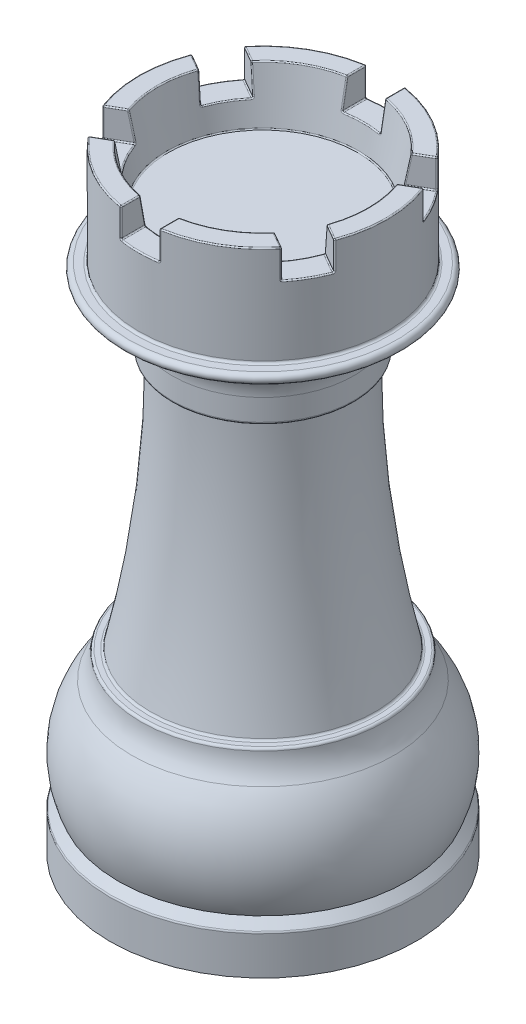
from build123d import *

# Parameters (mm, degrees)
CUT_EXTRUDE3_DEPTH = 3
FILLET1_R          = 0.125
SCALE1_SCALE       = 0.71875
SKETCH3_R          = 10.2
CUT_EXTRUDE4_DEPTH = 9
SKETCH6_W          = 10.75
SKETCH6_H          = 1


with BuildPart() as part:
    # Sketch1 → Revolve1 (revolve)
    with BuildSketch(Plane.XY):
        with BuildLine():
            Line((16, 4), (16, 0))
            Line((16, 0), (0, 0))
            Line((0, 0), (0, 58.5))
            Line((0, 58.5), (10.030205099, 58.5))
            Line((10.030205099, 58.5), (11, 63.99998019))
            Line((11, 63.99998019), (13, 63.99998019))
            Line((13, 63.99998019), (13, 53.78125))
            ThreePointArc((13, 53.78125), (13.073223305, 53.604473305), (13.25, 53.53125))
            Line((13.25, 53.53125), (14.03125, 53.53125))
            ThreePointArc((14.03125, 53.53125), (14.53125, 53.03125), (14.03125, 52.53125))
            ThreePointArc((14.03125, 52.53125), (10.827172398, 51.204077602), (9.5, 48))
            Line((9.5, 48), (9.5, 45.75))
            ThreePointArc((9.5, 45.75), (9.426776695, 45.573223305), (9.25, 45.5))
            Line((9.25, 45.5), (9, 45.5))
            ThreePointArc((9, 45.5), (8.823531814, 45.427084667), (8.75000152, 45.250871834))
            ThreePointArc((8.75000152, 45.250871834), (9.480787471, 31.884631978), (11.756493413, 18.693287147))
            ThreePointArc((11.756493413, 18.693287147), (11.844552759, 18.554195339), (12, 18.5))
            Line((12, 18.5), (12.5, 18.5))
            ThreePointArc((12.5, 18.5), (12.672025963, 18.431403054), (12.749648281, 18.263256543))
            ThreePointArc((12.749648281, 18.263256543), (13.034996076, 16.915224998), (13.719280159, 15.719245189))
            ThreePointArc((13.719280159, 15.719245189), (15.914405684, 10.553717167), (15.103553391, 5))
            Line((15.103553391, 5), (15.926776695, 4.176776695))
            ThreePointArc((15.926776695, 4.176776695), (15.980969883, 4.095670858), (16, 4))
        make_face()
    revolve(axis=Axis((0, 0, 0), (0, -1, 0)))

    # Sketch2 → Cut-Extrude3 (cut)
    with BuildSketch(Plane(origin=(0, 63.99998019, 0), x_dir=(1, 0, 0), z_dir=(0, 1, 0))):
        Polygon((13.46466686, 5.464427959), (11.46466686, 8.928529574), (2, 3.464101615), (2, 14.392957534), (-2, 14.392957534), (-2, 3.464101615), (-11.46466686, 8.928529574), (-13.46466686, 5.464427959), (-4, 0), (-13.46466686, -5.464427959), (-11.46466686, -8.928529574), (-2, -3.464101615), (-2, -14.392957534), (2, -14.392957534), (2, -3.464101615), (11.46466686, -8.928529574), (13.46466686, -5.464427959), (4, 0), align=None)
    extrude(amount=-CUT_EXTRUDE3_DEPTH, mode=Mode.SUBTRACT)

    # Fillet1
    fillet1_edges = [part.edges().sort_by_distance(p)[0] for p in [
        (12.124297731, 62.49998019, -4.690565482),
        (10.124297731, 62.49998019, -8.154667097),
        (2, 62.49998019, -12.845232579),
        (-2, 62.49998019, -12.845232579),
        (-10.124297731, 62.49998019, -8.154667097),
        (-12.124297731, 62.49998019, -4.690565482),
        (-12.124297731, 62.49998019, 4.690565482),
        (-10.124297731, 62.49998019, 8.154667097),
        (-2, 62.49998019, 12.845232579),
        (2, 62.49998019, 12.845232579),
        (10.124297731, 62.49998019, 8.154667097),
        (12.124297731, 62.49998019, 4.690565482),
        (6.5, 63.99998019, -11.258330249),
        (9.245897364, 63.99998019, -7.647522409),
        (2, 63.99998019, -11.830943203),
        (-9.245897364, 63.99998019, -7.647522409),
        (-6.5, 63.99998019, -11.258330249),
        (-2, 63.99998019, -11.830943203),
        (-11.245897364, 63.99998019, -4.183420794),
        (-11.245897364, 63.99998019, 4.183420794),
        (-13, 63.99998019, 0),
        (-9.245897364, 63.99998019, 7.647522409),
        (-2, 63.99998019, 11.830943203),
        (-6.5, 63.99998019, 11.258330249),
        (9.245897364, 63.99998019, 7.647522409),
        (6.5, 63.99998019, 11.258330249),
        (2, 63.99998019, 11.830943203),
        (12.77919932, 63.99998019, -2.385804843),
        (11.245897364, 63.99998019, 4.183420794),
        (11.245897364, 63.99998019, -4.183420794),
        (11.012757815, 60.99998019, -4.048817612),
        (9.012757815, 60.99998019, -7.512919227),
        (11.258330249, 60.99998019, -6.5),
        (2, 60.99998019, -11.561736839),
        (-2, 60.99998019, -11.561736839),
        (0, 60.99998019, -13),
        (-9.012757815, 60.99998019, -7.512919227),
        (-11.012757815, 60.99998019, -4.048817612),
        (-11.258330249, 60.99998019, -6.5),
        (-11.012757815, 60.99998019, 4.048817612),
        (-9.012757815, 60.99998019, 7.512919227),
        (-11.258330249, 60.99998019, 6.5),
        (-2, 60.99998019, 11.561736839),
        (2, 60.99998019, 11.561736839),
        (0, 60.99998019, 13),
        (9.012757815, 60.99998019, 7.512919227),
        (11.012757815, 60.99998019, 4.048817612),
        (11.258330249, 60.99998019, 6.5),
        (-9.068168508, 60.99998019, 5.235509529),
        (-10.13445755, 62.499959445, 3.541730718),
        (-11, 63.99998019, 0),
        (-10.13445755, 62.499959445, -3.541730718),
        (-9.068168508, 60.99998019, -5.235509529),
        (-8.13445755, 62.499959445, -7.005832333),
        (-5.5, 63.99998019, -9.526279442),
        (-2, 62.499959445, -10.547563051),
        (0, 60.99998019, -10.471019058),
        (2, 62.499959445, -10.547563051),
        (5.5, 63.99998019, -9.526279442),
        (8.13445755, 62.499959445, -7.005832333),
        (9.068168508, 60.99998019, -5.235509529),
        (10.13445755, 62.499959445, -3.541730718),
        (10.840721078, 63.99998019, -1.865145172),
        (10.13445755, 62.499959445, 3.541730718),
        (9.068168508, 60.99998019, 5.235509529),
        (8.13445755, 62.499959445, 7.005832333),
        (5.5, 63.99998019, 9.526279442),
        (2, 62.499959445, 10.547563051),
        (0, 60.99998019, 10.471019058),
        (-2, 62.499959445, 10.547563051),
        (-5.5, 63.99998019, 9.526279442),
        (-8.13445755, 62.499959445, 7.005832333),
        (-10.030205099, 58.5, 0),
    ]]
    fillet(fillet1_edges, radius=FILLET1_R)


with BuildPart() as part_1:
    # Scale1: scaled about (0, 0, 0)
    add(part.part.scale(SCALE1_SCALE))

    # Sketch3 → Cut-Extrude4 (cut)
    with BuildSketch(Plane.XZ):
        Circle(SKETCH3_R)
    extrude(amount=-CUT_EXTRUDE4_DEPTH, mode=Mode.SUBTRACT)

    # Sketch6 → Cut-Revolve1 (revolve, cut)
    with BuildSketch(Plane.XY):
        with Locations((-5.375, 0.5)):
            Rectangle(SKETCH6_W, SKETCH6_H)
    revolve(axis=Axis((0, 0, 0), (0, -1, 0)), mode=Mode.SUBTRACT)


with BuildPart() as body_2:
    # Sketch8 → Base (White Rook) (revolve)
    with BuildSketch(Plane.XY):
        Polygon((-10, 2.5), (-10, 1), (-10.55, 1), (-10.55, 0), (0, 0), (0, 2.5), align=None)
    revolve(axis=Axis((0, 0, 0), (0, -1, 0)))


solid = Compound([part_1.part, body_2.part])
